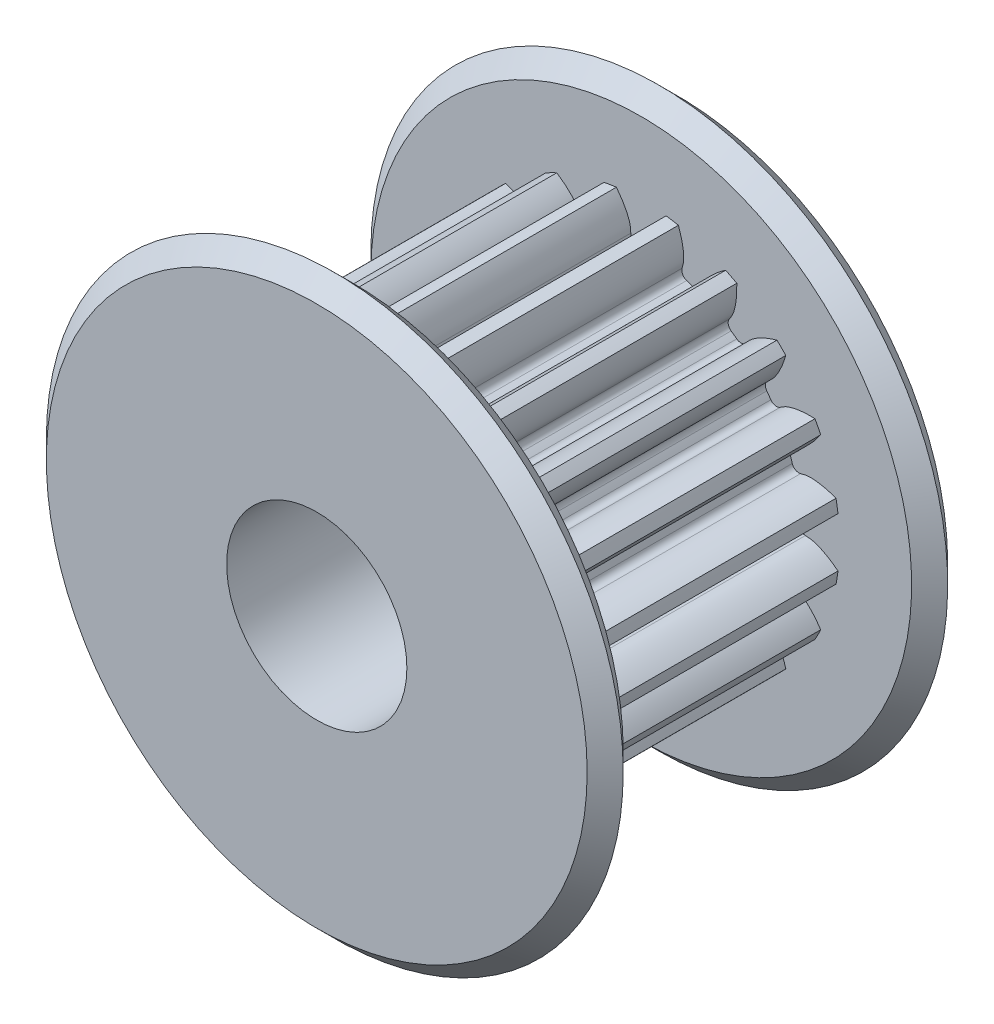
from build123d import *

# Parameters (mm, degrees)
SKETCH_1_R               = 5.5
LASHENA_DEPTH            = 8
CUT_EXTRUDEA_DEPTH       = 8
PATTERN_CIRCULAR_1_COUNT = 20
SKETCH_3_R               = 8
EXTRUDE_2_DEPTH          = 1
EXTRUDE_START            = 6
SKETCH_4_R               = 8
EXTRUDE_3_DEPTH          = 6
CHAMFER_1_SIZE           = 0.5
SKETCH_5_R               = 2.5
CUT_EXTRUDE_2_DEPTH      = 16
CUT_EXTRUDE_START        = 10
SKETCH_6_W               = 5
SKETCH_6_H               = 16
CUT_EXTRUDE_3_DEPTH      = 20
CHAMFER_2_SIZE           = 0.5


with BuildPart() as part:
    # 草图1 → LaShenA (new body)
    with BuildSketch(Plane.XY):
        Circle(SKETCH_1_R)
    extrude(amount=LASHENA_DEPTH)

    # SketchA → Cut-ExtrudeA (cut)
    with BuildSketch(Plane.XY.offset(8)):
        with BuildLine():
            ThreePointArc((0.096333474, 4.373939284), (0, 4.375), (-0.096333474, 4.373939284))
            ThreePointArc((-0.096333474, 4.373939284), (-0.229140321, 4.424050211), (-0.290157725, 4.552212763))
            add(Edge.make_bspline(
                [(-0.290157725, 4.552212763), (-0.292982519, 4.598075336), (-0.294060313, 4.658145107), (-0.304014503, 4.724212241), (-0.310185924, 4.752129248), (-0.315629723, 4.77423201), (-0.322624857, 4.799548846), (-0.331322283, 4.828017157), (-0.341907625, 4.859557712), (-0.354551332, 4.894087042), (-0.369424477, 4.931513561), (-0.386693401, 4.971738946), (-0.406521044, 5.014657874), (-0.429066204, 5.060158271), (-0.454483438, 5.108121423), (-0.482922771, 5.158422139), (-0.514529478, 5.210928903), (-0.549443843, 5.265504049), (-0.587800934, 5.322003932), (-0.629730381, 5.380279116), (-0.675356176, 5.44017456), (-0.724796396, 5.501529824), (-0.797466189, 5.586839692), (-0.855800311, 5.649793348), (-0.896573685, 5.69154901)],
                knots=[0.125068197, 0.125068197, 0.125068197, 0.125068197, 0.215847125, 0.244833276, 0.257593391, 0.272673526, 0.290073681, 0.309793857, 0.331834054, 0.356194271, 0.382874509, 0.411874767, 0.443195046, 0.476835345, 0.512795666, 0.551076006, 0.591676368, 0.634596749, 0.679837152, 0.727397575, 0.777278019, 0.829478483, 0.883998968, 1, 1, 1, 1], degree=3))
            ThreePointArc((-0.896573685, 5.69154901), (0, 5.761733638), (0.896573685, 5.69154901))
            add(Edge.make_bspline(
                [(0.290157725, 4.552212763), (0.292982519, 4.598075336), (0.294060313, 4.658145107), (0.304014503, 4.724212241), (0.310185924, 4.752129248), (0.315629723, 4.77423201), (0.322624857, 4.799548846), (0.331322283, 4.828017157), (0.341907625, 4.859557712), (0.354551332, 4.894087042), (0.369424477, 4.931513561), (0.386693401, 4.971738946), (0.406521044, 5.014657874), (0.429066204, 5.060158271), (0.454483438, 5.108121423), (0.482922771, 5.158422139), (0.514529478, 5.210928903), (0.549443843, 5.265504049), (0.587800934, 5.322003932), (0.629730381, 5.380279116), (0.675356176, 5.44017456), (0.724796396, 5.501529824), (0.797466189, 5.586839692), (0.855800311, 5.649793348), (0.896573685, 5.69154901)],
                knots=[0.125068197, 0.125068197, 0.125068197, 0.125068197, 0.215847125, 0.244833276, 0.257593391, 0.272673526, 0.290073681, 0.309793857, 0.331834054, 0.356194271, 0.382874509, 0.411874767, 0.443195046, 0.476835345, 0.512795666, 0.551076006, 0.591676368, 0.634596749, 0.679837152, 0.727397575, 0.777278019, 0.829478483, 0.883998968, 1, 1, 1, 1], degree=3))
            ThreePointArc((0.290157725, 4.552212763), (0.229140321, 4.424050211), (0.096333474, 4.373939284))
        make_face()
    cut_extrudea = extrude(amount=-CUT_EXTRUDEA_DEPTH, mode=Mode.SUBTRACT)

    # 阵列(圆周)1: Cut-ExtrudeA ×20 about axis
    pattern_circular_1_axis = Axis((0, 0, -88.99), (0, 0, 1))
    for i in range(1, PATTERN_CIRCULAR_1_COUNT):
        add(cut_extrudea.rotate(pattern_circular_1_axis, i * 360 / PATTERN_CIRCULAR_1_COUNT), mode=Mode.SUBTRACT)

    # 草图3 → 凸台-拉伸2 (add)
    with BuildSketch(Plane.XY.offset(8)):
        Circle(SKETCH_3_R)
    extrude(amount=EXTRUDE_2_DEPTH)

    # 草图4 → 凸台-拉伸3 (add)
    with BuildSketch(Plane(origin=(0, 0, 0), x_dir=(-1, 0, 0), z_dir=(0, 0, -1)).offset(EXTRUDE_START)):
        with Locations(Location((0, 0, 0), (0, 0, 180))):
            Circle(SKETCH_4_R)
    extrude(amount=-EXTRUDE_3_DEPTH)

    # 倒角1
    chamfer_1_edges = [part.edges().sort_by_distance(p)[0] for p in [
        (-8, 0, 8),
        (-8, 0, 9),
        (-8, 0, 0),
        (-8, 0, -6),
    ]]
    chamfer(chamfer_1_edges, length=CHAMFER_1_SIZE - 0.0001)  # a hair under: the kernel refuses the full size

    # 草图5 → 切除-拉伸2 (cut)
    with BuildSketch(Plane.XY.offset(9)):
        Circle(SKETCH_5_R)
    extrude(amount=-CUT_EXTRUDE_2_DEPTH, mode=Mode.SUBTRACT)

    # 草图6 → 切除-拉伸3 (cut)
    with BuildSketch(Plane(origin=(0, 0, 0), x_dir=(0, 0, -1), z_dir=(1, 0, 0)).offset(CUT_EXTRUDE_START)):
        with Locations((3.5, 0)):
            Rectangle(SKETCH_6_W, SKETCH_6_H)
    extrude(amount=-CUT_EXTRUDE_3_DEPTH, mode=Mode.SUBTRACT)

    # 倒角2
    chamfer_2_edges = [part.edges().sort_by_distance(p)[0] for p in [
        (-8, 0, -1),
    ]]
    chamfer(chamfer_2_edges, length=CHAMFER_2_SIZE)


solid = part.part
